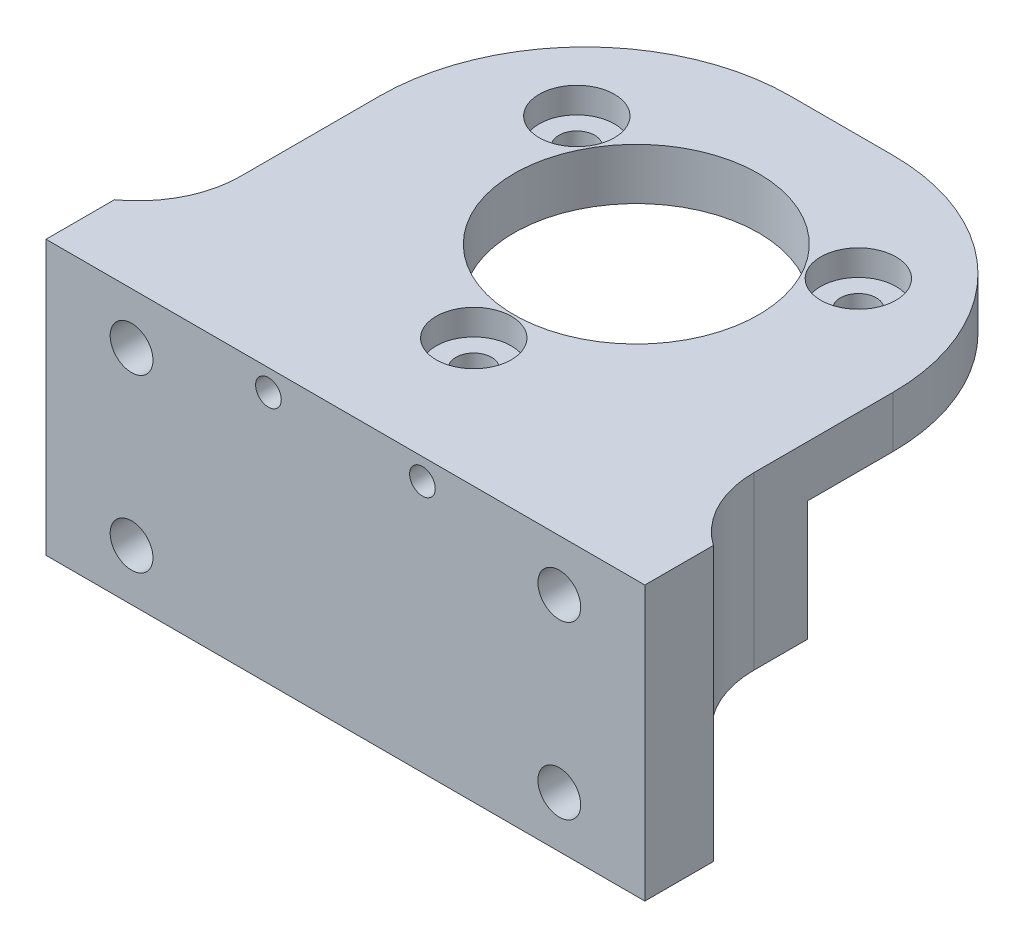
from build123d import *

# Parameters (mm, degrees)
SKETCH1_W                           = 30
SKETCH1_H                           = 10
MAIN_DEPTH                          = 25
SKETCH5_R                           = 1.05
SKETCH5_R_2                         = 7.15
MAINANDFIXHOLE_DEPTH                = 31.822070015
SKETCH6_R                           = 2.2
CODERFIXHOLE2_DEPTH                 = 1.5
CODERHOLE2_DEPTH                    = 7
SKETCH10_W                          = 35
SKETCH10_H                          = 16
LINK_DEPTH                          = 4
SKETCH8_R                           = 1.25
VERTICALHOLES_DEPTH                 = 12
SKETCH13_R                          = 2.5
LINKREINFORCEMENT_DEPTH             = 2
FILLET4_R                           = 6
FILLET6_R                           = 12
HOLELPATTERN1_COUNT                 = 2
HOLELPATTERN1_PITCH                 = 25
HOLELPATTERN1_COUNT_DIR2            = 2
HOLELPATTERN1_PITCH_DIR2            = 10
HOLETOACCESSENCODERSCREW_REACH      = 37.612
HOLETOACCESSENCODERSCREW_END_RADIUS = 7.15
SKETCH14_R                          = 0.75


with BuildPart() as part:
    # Sketch1 → Main (new body)
    with BuildSketch(Plane.XY):
        Rectangle(SKETCH1_W, SKETCH1_H)
    extrude(amount=MAIN_DEPTH)

    # Sketch5 → MainAndFixHole (cut, through all)
    with BuildSketch(Plane(origin=(0, -5, 0), x_dir=(-1, 0, 0), z_dir=(0, -1, 0))):
        with Locations(Location((0, -21.5, 0), (0, 0, 90))):
            Circle(SKETCH5_R)
        with Locations(Location((-8.227241336, -7.25, 0), (0, 0, 90))):
            Circle(SKETCH5_R)
        with Locations(Location((8.227241336, -7.25, 0), (0, 0, 90))):
            Circle(SKETCH5_R)
        with Locations(Location((0, -12, 0), (0, 0, 90))):
            Circle(SKETCH5_R_2)
    extrude(amount=-MAINANDFIXHOLE_DEPTH, mode=Mode.SUBTRACT)

    # Sketch6 → CoderFixHole2 (cut)
    with BuildSketch(Plane(origin=(0, 5, 0), x_dir=(-1, 0, 0), z_dir=(0, -1, 0))):
        with Locations(Location((0, -21.5, 0), (0, 0, 90))):
            Circle(SKETCH6_R)
        with Locations(Location((-8.227241336, -7.25, 0), (0, 0, 90))):
            Circle(SKETCH6_R)
        with Locations(Location((8.227241336, -7.25, 0), (0, 0, 90))):
            Circle(SKETCH6_R)
    extrude(amount=CODERFIXHOLE2_DEPTH, mode=Mode.SUBTRACT)

    # Sketch11 → CoderHole2 (cut)
    with BuildSketch(Plane(origin=(0, -5, 0), x_dir=(1, 0, 0), z_dir=(0, 1, 0))):
        with BuildLine():
            Line((-15, 0), (15, 0))
            Line((15, 0), (15, -17))
            Line((15, -17), (10.908712115, -17))
            ThreePointArc((10.908712115, -17), (0, -24), (-10.908712115, -17))
            Line((-10.908712115, -17), (-15, -17))
            Line((-15, -17), (-15, 0))
        make_face()
    extrude(amount=CODERHOLE2_DEPTH, mode=Mode.SUBTRACT)

    # Sketch10 → Link (add)
    with BuildSketch(Plane.XY.offset(25)):
        with Locations((0, -3)):
            Rectangle(SKETCH10_W, SKETCH10_H)
    extrude(amount=LINK_DEPTH)

    # Sketch8 → VerticalHoles (cut)
    with BuildSketch(Plane.XY.offset(29)):
        with Locations((12.5, 2)):
            Circle(SKETCH8_R)
    verticalholes = extrude(amount=-VERTICALHOLES_DEPTH, mode=Mode.SUBTRACT)

    # Sketch13 → LinkReinforcement (add)
    with BuildSketch(Plane(origin=(0, 0, 25), x_dir=(-1, 0, 0), z_dir=(0, 0, -1))):
        with Locations((-12.5, -8)):
            Circle(SKETCH13_R)
        with Locations((12.5, -8)):
            Circle(SKETCH13_R)
    extrude(amount=LINKREINFORCEMENT_DEPTH)

    # Fillet4
    # the kernel refuses this fillet: 6 mm, written as the material it adds along each edge
    with BuildSketch(Plane(origin=(15, -5, 25), x_dir=(1, 0, 0), z_dir=(0, 1, 0)), Plane(origin=(-15, 5, 25), x_dir=(-1, 0, 0), z_dir=(0, -1, 0))) as fillet4_piece_1:
        with BuildLine():
            CenterArc((6, 4.873397172), FILLET4_R, 180, 54.314665287)
            Line((0, 4.873397172), (-0.12, 4.873397172))
            Line((-0.12, 4.873397172), (-0.12, 0))
            Line((-0.12, 0), (0, -0.12))
            ThreePointArc((0, -0.12), (1.25, -0.12), (2.43, -0.097467943))
            Line((2.43, -0.097467943), (2.5, 0))
        make_face()
    extrude(amount=10)

    # Fillet6
    fillet6_edges = [part.edges().sort_by_distance(p)[0] for p in [
        (-15, 3.5, 0),
        (15, 3.5, 0),
    ]]
    fillet(fillet6_edges, radius=FILLET6_R)

    # HoleLPattern1: VerticalHoles 2 × 2
    with Locations(*[(-i * HOLELPATTERN1_PITCH, -j * HOLELPATTERN1_PITCH_DIR2, 0) for i in range(HOLELPATTERN1_COUNT) for j in range(HOLELPATTERN1_COUNT_DIR2) if (i, j) != (0, 0)]):
        add(verticalholes, mode=Mode.SUBTRACT)

    # HoleToAccessEncoderScrew: up to this cylinder (the profile starts outside it)
    holetoaccessencoderscrew_end = Plane(origin=(0, 3.75, 12), z_dir=(0, -1, 0)) * Cylinder(HOLETOACCESSENCODERSCREW_END_RADIUS, 90.524, mode=Mode.PRIVATE)
    # Sketch14 → HoleToAccessEncoderScrew (cut, up to the surface)
    with BuildSketch(Plane.XY.offset(29), mode=Mode.PRIVATE) as holetoaccessencoderscrew_sk1:
        with Locations((4.5, 3.75)):
            Circle(SKETCH14_R)
    holetoaccessencoderscrew_tool1 = extrude(holetoaccessencoderscrew_sk1.sketch, amount=-HOLETOACCESSENCODERSCREW_REACH, mode=Mode.PRIVATE) - holetoaccessencoderscrew_end
    add(holetoaccessencoderscrew_tool1.solids().sort_by_distance((4.5, 3.75, 29))[0], mode=Mode.SUBTRACT)
    # Sketch14 → HoleToAccessEncoderScrew (cut, up to the surface)
    with BuildSketch(Plane.XY.offset(29), mode=Mode.PRIVATE) as holetoaccessencoderscrew_sk2:
        with Locations((-4.5, 3.75)):
            Circle(SKETCH14_R)
    holetoaccessencoderscrew_tool2 = extrude(holetoaccessencoderscrew_sk2.sketch, amount=-HOLETOACCESSENCODERSCREW_REACH, mode=Mode.PRIVATE) - holetoaccessencoderscrew_end
    add(holetoaccessencoderscrew_tool2.solids().sort_by_distance((-4.5, 3.75, 29))[0], mode=Mode.SUBTRACT)


solid = part.part
